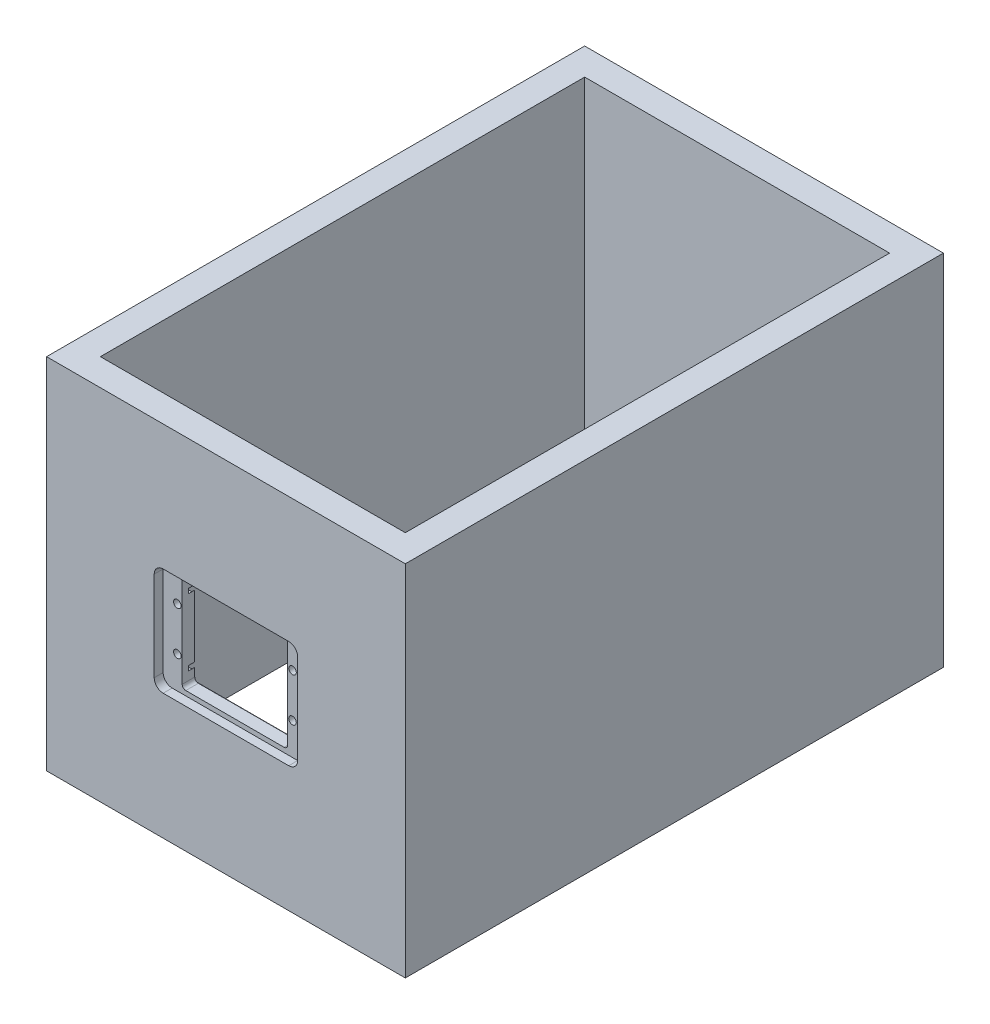
from build123d import *

# Parameters (mm, degrees)
SKETCH_1_W          = 200
SKETCH_1_H          = 200
EXTRUDE_1_DEPTH     = 300
SKETCH_2_W          = 170
SKETCH_2_H          = 270
CUT_EXTRUDE_1_DEPTH = 375.165738677
CUT_EXTRUDE_2_REACH = 333.662
SKETCH_3_R          = 7.5
CUT_EXTRUDE_3_REACH = 320.159
SKETCH_4_R          = 2.1
CUT_EXTRUDE_4_DEPTH = 5
CUT_EXTRUDE_5_DEPTH = 3
SKETCH_7_R          = 3
CUT_EXTRUDE_6_DEPTH = 3.5


with BuildPart() as part:
    # 草圖1 → 填料-伸長1 (new body)
    with BuildSketch(Plane.XY):
        Rectangle(SKETCH_1_W, SKETCH_1_H)
    extrude(amount=EXTRUDE_1_DEPTH)

    # 草圖2 → 除料-伸長1 (cut, through all)
    with BuildSketch(Plane.XZ.offset(100)):
        with Locations((0, 150)):
            Rectangle(SKETCH_2_W, SKETCH_2_H)
    extrude(amount=-CUT_EXTRUDE_1_DEPTH, mode=Mode.SUBTRACT)

    # 草圖3 → 除料-伸長2 (cut, up to next)
    with BuildSketch(Plane(origin=(0, 0, 0), x_dir=(-1, 0, 0), z_dir=(0, 0, -1)), mode=Mode.PRIVATE) as cut_extrude_2_sk1:
        Circle(SKETCH_3_R)
    cut_extrude_2_tool1 = extrude(cut_extrude_2_sk1.sketch, amount=-CUT_EXTRUDE_2_REACH, mode=Mode.PRIVATE) & part.part
    add(cut_extrude_2_tool1.solids().sort_by_distance((0, 0, 0))[0], mode=Mode.SUBTRACT)

    # 草圖4 → 除料-伸長3 (cut, up to next)
    with BuildSketch(Plane(origin=(0, 0, 285), x_dir=(-1, 0, 0), z_dir=(0, 0, -1)), mode=Mode.PRIVATE) as cut_extrude_3_sk1:
        with Locations((-32.1, 12.1)):
            Circle(SKETCH_4_R)
    cut_extrude_3_tool1 = extrude(cut_extrude_3_sk1.sketch, amount=-CUT_EXTRUDE_3_REACH, mode=Mode.PRIVATE) & part.part
    # 草圖4 → 除料-伸長3 (cut, up to next)
    with BuildSketch(Plane(origin=(0, 0, 285), x_dir=(-1, 0, 0), z_dir=(0, 0, -1)), mode=Mode.PRIVATE) as cut_extrude_3_sk2:
        with Locations((32.1, 12.1)):
            Circle(SKETCH_4_R)
    cut_extrude_3_tool2 = extrude(cut_extrude_3_sk2.sketch, amount=-CUT_EXTRUDE_3_REACH, mode=Mode.PRIVATE) & part.part
    # 草圖4 → 除料-伸長3 (cut, up to next)
    with BuildSketch(Plane(origin=(0, 0, 285), x_dir=(-1, 0, 0), z_dir=(0, 0, -1)), mode=Mode.PRIVATE) as cut_extrude_3_sk3:
        with Locations((32.1, -12.1)):
            Circle(SKETCH_4_R)
    cut_extrude_3_tool3 = extrude(cut_extrude_3_sk3.sketch, amount=-CUT_EXTRUDE_3_REACH, mode=Mode.PRIVATE) & part.part
    # 草圖4 → 除料-伸長3 (cut, up to next)
    with BuildSketch(Plane(origin=(0, 0, 285), x_dir=(-1, 0, 0), z_dir=(0, 0, -1)), mode=Mode.PRIVATE) as cut_extrude_3_sk4:
        with Locations((-32.1, -12.1)):
            Circle(SKETCH_4_R)
    cut_extrude_3_tool4 = extrude(cut_extrude_3_sk4.sketch, amount=-CUT_EXTRUDE_3_REACH, mode=Mode.PRIVATE) & part.part
    # 草圖4 → 除料-伸長3 (cut, up to next)
    with BuildSketch(Plane(origin=(0, 0, 285), x_dir=(-1, 0, 0), z_dir=(0, 0, -1)), mode=Mode.PRIVATE) as cut_extrude_3_sk5:
        with BuildLine():
            Line((27.4, 27.4), (-27.4, 27.4))
            ThreePointArc((-27.4, 27.4), (-28.814213562, 26.814213562), (-29.4, 25.4))
            Line((-29.4, 25.4), (-29.4, -25.4))
            ThreePointArc((-29.4, -25.4), (-28.814213562, -26.814213562), (-27.4, -27.4))
            Line((-27.4, -27.4), (27.4, -27.4))
            ThreePointArc((27.4, -27.4), (28.814213562, -26.814213562), (29.4, -25.4))
            Line((29.4, -25.4), (29.4, 25.4))
            ThreePointArc((29.4, 25.4), (28.814213562, 26.814213562), (27.4, 27.4))
        make_face()
    cut_extrude_3_tool5 = extrude(cut_extrude_3_sk5.sketch, amount=-CUT_EXTRUDE_3_REACH, mode=Mode.PRIVATE) & part.part
    add(cut_extrude_3_tool1.solids().sort_by_distance((32.1, 12.1, 285))[0], mode=Mode.SUBTRACT)
    add(cut_extrude_3_tool2.solids().sort_by_distance((-32.1, 12.1, 285))[0], mode=Mode.SUBTRACT)
    add(cut_extrude_3_tool3.solids().sort_by_distance((-32.1, -12.1, 285))[0], mode=Mode.SUBTRACT)
    add(cut_extrude_3_tool4.solids().sort_by_distance((32.1, -12.1, 285))[0], mode=Mode.SUBTRACT)
    add(cut_extrude_3_tool5.solids().sort_by_distance((0, 0, 285))[0], mode=Mode.SUBTRACT)

    # 草圖5 → 除料-伸長4 (cut)
    with BuildSketch(Plane.XY.offset(300)):
        with BuildLine():
            Line((-35, 30), (35, 30))
            ThreePointArc((35, 30), (38.535533906, 28.535533906), (40, 25))
            Line((40, 25), (40, -25))
            ThreePointArc((40, -25), (38.535533906, -28.535533906), (35, -30))
            Line((35, -30), (-35, -30))
            ThreePointArc((-35, -30), (-38.535533906, -28.535533906), (-40, -25))
            Line((-40, -25), (-40, 25))
            ThreePointArc((-40, 25), (-38.535533906, 28.535533906), (-35, 30))
        make_face()
    extrude(amount=-CUT_EXTRUDE_4_DEPTH, mode=Mode.SUBTRACT)

    # 草圖6 → 除料-伸長5 (cut)
    with BuildSketch(Plane(origin=(0, 0, 285), x_dir=(-1, 0, 0), z_dir=(0, 0, -1))):
        with BuildLine():
            Line((-33.25, 30.25), (33.25, 30.25))
            ThreePointArc((33.25, 30.25), (36.785533906, 28.785533906), (38.25, 25.25))
            Line((38.25, 25.25), (38.25, -25.25))
            ThreePointArc((38.25, -25.25), (36.785533906, -28.785533906), (33.25, -30.25))
            Line((33.25, -30.25), (-33.25, -30.25))
            ThreePointArc((-33.25, -30.25), (-36.785533906, -28.785533906), (-38.25, -25.25))
            Line((-38.25, -25.25), (-38.25, 25.25))
            ThreePointArc((-38.25, 25.25), (-36.785533906, 28.785533906), (-33.25, 30.25))
        make_face()
    extrude(amount=-CUT_EXTRUDE_5_DEPTH, mode=Mode.SUBTRACT)

    # 草圖7 → 除料-伸長6 (cut)
    with BuildSketch(Plane(origin=(0, 0, 288), x_dir=(-1, 0, 0), z_dir=(0, 0, -1))):
        with Locations((-32.1, -19.4)):
            Circle(SKETCH_7_R)
        with BuildLine():
            Line((-29.4, 18.092330317), (-29.4, 20.707669683))
            ThreePointArc((-29.4, 20.707669683), (-35.1, 19.4), (-29.4, 18.092330317))
        make_face()
        with Locations((32.1, 17.9)):
            Circle(SKETCH_7_R)
        with BuildLine():
            ThreePointArc((29.4, -20.707669683), (35.1, -19.4), (29.4, -18.092330317))
            Line((29.4, -18.092330317), (29.4, -20.707669683))
        make_face()
    extrude(amount=-CUT_EXTRUDE_6_DEPTH, mode=Mode.SUBTRACT)


solid = part.part
